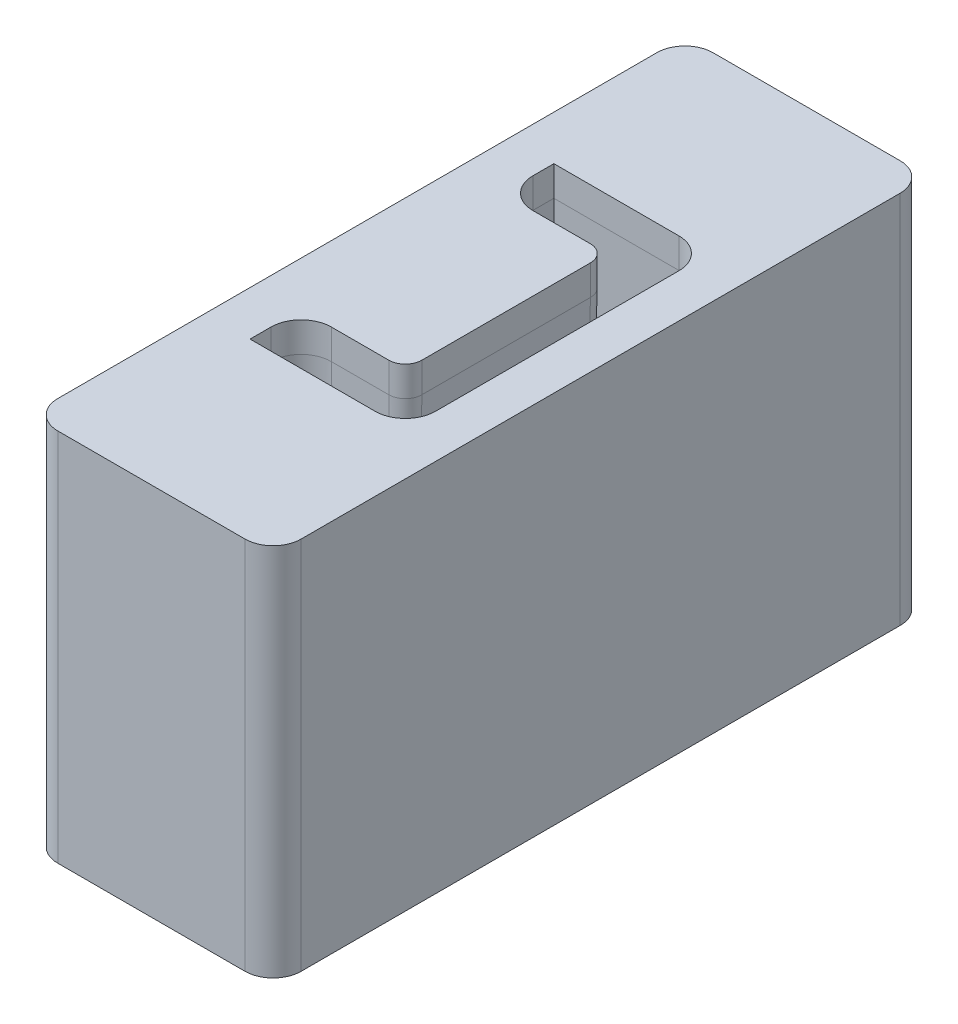
from build123d import *

# Parameters (mm, degrees)
SKETCH1_W             = 26
SKETCH1_H             = 70
BOSS_EXTRUDE1_DEPTH   = 40
FILLET1_R             = 3
CUT_EXTRUDE1_REACH    = 56.717
M8_TAPPED_HOLE1_D     = 6.8
M8_TAPPED_HOLE1_DEPTH = 22.25
M8_TAPPED_HOLE1_TIP   = 2.042926105


with BuildPart() as part:
    # Sketch1 → Boss-Extrude1 (new body)
    with BuildSketch(Plane(origin=(0, 0, 0), x_dir=(1, 0, 0), z_dir=(0, 1, 0))):
        Rectangle(SKETCH1_W, SKETCH1_H)
    extrude(amount=-BOSS_EXTRUDE1_DEPTH)

    # Fillet1
    fillet1_edges = [part.edges().sort_by_distance(p)[0] for p in [
        (-13, -20, -35),
        (13, -20, -35),
        (-13, -20, 35),
        (13, -20, 35),
    ]]
    fillet(fillet1_edges, radius=FILLET1_R)

    # Sketch9 → Cut-Extrude1 (cut, up to next)
    with BuildSketch(Plane(origin=(0, 0, 0), x_dir=(1, 0, 0), z_dir=(0, 1, 0)), mode=Mode.PRIVATE) as cut_extrude1_sk1:
        with BuildLine():
            Line((2.9, 9), (2.9, -9))
            ThreePointArc((2.9, -9), (2.381579003, -10.251579003), (1.13, -10.77))
            Line((1.13, -10.77), (-5, -10.77))
            ThreePointArc((-5, -10.77), (-7.283954903, -11.716045097), (-8.23, -14))
            Line((-8.23, -14), (-8.23, -16.23))
            Line((-8.23, -16.23), (5.13, -16.23))
            ThreePointArc((5.13, -16.23), (7.413954903, -15.283954903), (8.36, -13))
            Line((8.36, -13), (8.36, 13))
            ThreePointArc((8.36, 13), (7.413954903, 15.283954903), (5.13, 16.23))
            Line((5.13, 16.23), (-8.23, 16.23))
            Line((-8.23, 16.23), (-8.23, 14))
            ThreePointArc((-8.23, 14), (-7.283954903, 11.716045097), (-5, 10.77))
            Line((-5, 10.77), (1.13, 10.77))
            ThreePointArc((1.13, 10.77), (2.381579003, 10.251579003), (2.9, 9))
        make_face()
    cut_extrude1_tool1 = extrude(cut_extrude1_sk1.sketch, amount=-CUT_EXTRUDE1_REACH, mode=Mode.PRIVATE) & part.part
    add(cut_extrude1_tool1.solids().sort_by_distance((3.264538, 0, 0))[0], mode=Mode.SUBTRACT)

    # Cut-Sweep1: sweep along a path in Sketch12
    with BuildLine(Plane(origin=(0, 0, 0), x_dir=(1, 0, 0), z_dir=(0, 1, 0))) as cut_sweep1_path:
        Line((-8.23, -14), (-8.23, -16.23))
        Line((-8.23, -16.23), (5.13, -16.23))
        ThreePointArc((5.13, -16.23), (7.413954903, -15.283954903), (8.36, -13))
        Line((8.36, -13), (8.36, 13))
        ThreePointArc((8.36, 13), (7.413954903, 15.283954903), (5.13, 16.23))
        Line((5.13, 16.23), (-8.23, 16.23))
        Line((-8.23, 16.23), (-8.23, 14))
        ThreePointArc((-8.23, 14), (-7.283954903, 11.716045097), (-5, 10.77))
        Line((-5, 10.77), (1.13, 10.77))
        ThreePointArc((1.13, 10.77), (2.381579003, 10.251579003), (2.9, 9))
        Line((2.9, 9), (2.9, -9))
        ThreePointArc((2.9, -9), (2.381579003, -10.251579003), (1.13, -10.77))
        Line((1.13, -10.77), (-5, -10.77))
        ThreePointArc((-5, -10.77), (-7.283954903, -11.716045097), (-8.23, -14))
    # Sketch11 → Cut-Sweep1 (sweep, cut)
    with BuildSketch(Plane.XY):
        Polygon((8.36, -3.2), (9.002346389, -40), (8.36, -40), align=None)
    sweep(path=cut_sweep1_path.line, transition=Transition.RIGHT, mode=Mode.SUBTRACT)

    # M8 Tapped Hole1
    with Locations(Plane(origin=(0, -40, 0), x_dir=(-1, 0, 0), z_dir=(0, -1, 0))):
        with Locations((0, -25.936173195), (0, 25.936173195)):
            Hole(M8_TAPPED_HOLE1_D / 2, depth=M8_TAPPED_HOLE1_DEPTH)
            with Locations((0, 0, -(M8_TAPPED_HOLE1_DEPTH + M8_TAPPED_HOLE1_TIP / 2))):  # 118° drill point
                Cone(0, M8_TAPPED_HOLE1_D / 2, M8_TAPPED_HOLE1_TIP, mode=Mode.SUBTRACT)


solid = part.part
